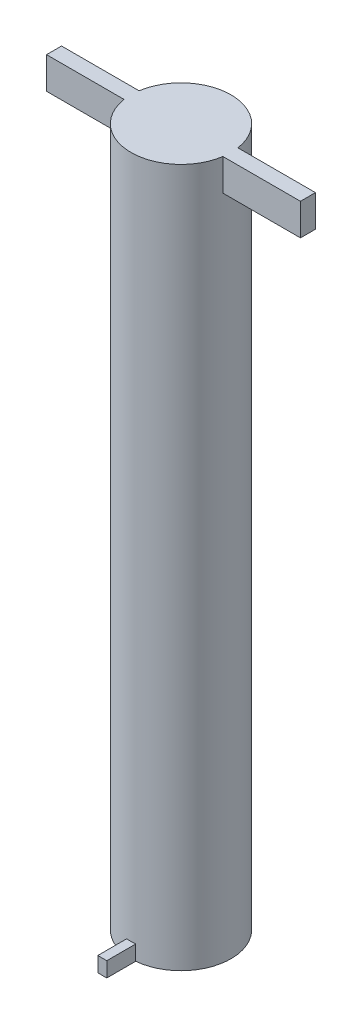
from build123d import *

# Parameters (mm, degrees)
SKETCH1_R           = 10
BOSS_EXTRUDE1_DEPTH = 139.7
BOSS_EXTRUDE2_DEPTH = 3
SKETCH4_W           = 50.8
SKETCH4_H           = 3
BOSS_EXTRUDE3_DEPTH = 6.35
SKETCH5_R           = 6.25
CUT_EXTRUDE1_DEPTH  = 4


with BuildPart() as part:
    # Sketch1 → Boss-Extrude1 (new body)
    with BuildSketch(Plane(origin=(0, 0, 0), x_dir=(1, 0, 0), z_dir=(0, 1, 0))):
        Circle(SKETCH1_R)
    extrude(amount=BOSS_EXTRUDE1_DEPTH)

    # Sketch3 → Boss-Extrude2 (add)
    with BuildSketch(Plane.XZ):
        with BuildLine():
            Line((-0.9, 15.75), (0.9, 15.75))
            Line((0.9, 15.75), (0.9, 9.354806465))
            ThreePointArc((0.9, 9.354806465), (0, 9.398), (-0.9, 9.354806465))
            Line((-0.9, 9.354806465), (-0.9, 15.75))
        make_face()
    extrude(amount=-BOSS_EXTRUDE2_DEPTH)

    # Sketch4 → Boss-Extrude3 (add)
    with BuildSketch(Plane(origin=(0, 139.7, 0), x_dir=(1, 0, 0), z_dir=(0, 1, 0))):
        Rectangle(SKETCH4_W, SKETCH4_H)
    extrude(amount=-BOSS_EXTRUDE3_DEPTH)

    # Sketch5 → Cut-Extrude1 (cut)
    with BuildSketch(Plane.XZ):
        Circle(SKETCH5_R)
    extrude(amount=-CUT_EXTRUDE1_DEPTH, mode=Mode.SUBTRACT)


solid = part.part
